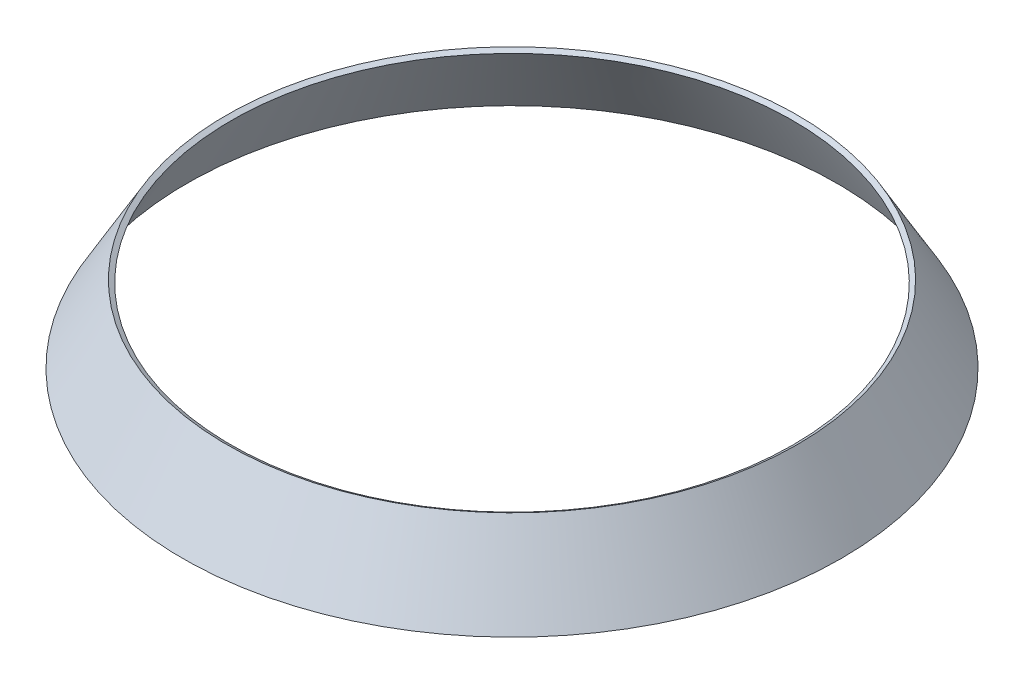
from build123d import *


with BuildPart() as part:
    # Sketch1 → Revolve1 (revolve)
    with BuildSketch(Plane.XY):
        Polygon((38.78, 5.371152423), (44.78, -5.021152423), (44.173782217, -5.371152423), (38.173782217, 5.021152423), align=None)
    revolve(axis=Axis((0, -1106.917829623, 0), (0, 1, 0)))


solid = part.part
